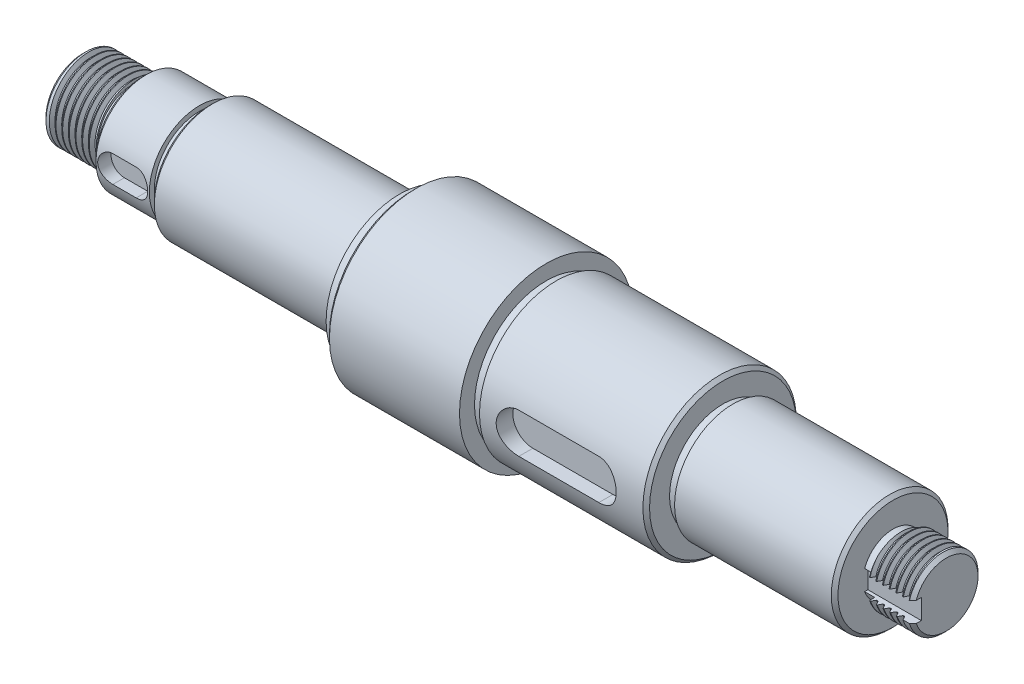
from build123d import *

# Parameters (mm, degrees)
SKETCH_1_W          = 3
SKETCH_1_H          = 10.5
SKETCH_1_H_2        = 13.5
SKETCH_1_H_3        = 16
SKETCH_1_H_4        = 21.5
CUT_EXTRUDE_1_DEPTH = 4
CUT_EXTRUDE_2_DEPTH = 5
SKETCH_4_W          = 16
SKETCH_4_H          = 6
CUT_EXTRUDE_3_DEPTH = 3
THREAD_4_PITCH      = 2
THREAD_5_PITCH      = 2


with BuildPart() as part:
    # 草图1 → 旋转1 (revolve)
    with BuildSketch(Plane.XY, mode=Mode.PRIVATE) as revolve_1_sk:
        Polygon((-212.024960712, 44.781802137), (-212.024960712, 46.281802137), (-226.024960712, 46.281802137), (-227.024960712, 45.281802137), (-227.024960712, 34.281802137), (-212.024960712, 34.281802137), align=None)
        with Locations((-210.524960712, 39.531802137)):
            Rectangle(SKETCH_1_W, SKETCH_1_H)
        Polygon((-209.024960712, 46.507366847), (-209.024960712, 44.781802137), (-209.024960712, 34.281802137), (-192.024960712, 34.281802137), (-192.024960712, 47.781802137), (-192.024960712, 49.281802137), (-208.024960712, 49.281802137), (-209.024960712, 48.281802137), align=None)
        with Locations((-190.524960712, 41.031802137)):
            Rectangle(SKETCH_1_W, SKETCH_1_H_2)
        Polygon((-189.024960712, 47.781802137), (-189.024960712, 34.281802137), (-135.024960712, 34.281802137), (-135.024960712, 50.281802137), (-135.024960712, 51.781802137), (-188.024960712, 51.781802137), (-189.024960712, 50.781802137), (-189.024960712, 49.281802137), align=None)
        with Locations((-133.524960712, 42.281802137)):
            Rectangle(SKETCH_1_W, SKETCH_1_H_3)
        Polygon((-132.024960712, 50.281802137), (-132.024960712, 34.281802137), (-128.024960712, 34.281802137), (-128.024960712, 56.281802137), (-132.024960712, 56.281802137), (-132.024960712, 51.781802137), align=None)
        Polygon((-128.024960712, 56.281802137), (-128.024960712, 34.281802137), (-88.024960712, 34.281802137), (-88.024960712, 55.781802137), (-88.024960712, 57.281802137), (-88.024960712, 60.281802137), (-127.024960712, 60.281802137), (-128.024960712, 59.281802137), align=None)
        Polygon((-85.024960712, 55.781802137), (-85.024960712, 34.281802137), (-35.024960712, 34.281802137), (-35.024960712, 50.281802137), (-35.024960712, 51.781802137), (-35.024960712, 56.281802137), (-36.024960712, 57.281802137), (-85.024960712, 57.281802137), align=None)
        with Locations((-86.524960712, 45.031802137)):
            Rectangle(SKETCH_1_W, SKETCH_1_H_4)
        with Locations((-33.524960712, 42.281802137)):
            Rectangle(SKETCH_1_W, SKETCH_1_H_3)
        Polygon((-32.024960712, 50.281802137), (-32.024960712, 34.281802137), (15.975039288, 34.281802137), (15.975039288, 42.8463656), (15.975039288, 43.281802137), (15.975039288, 50.781802137), (14.975039288, 51.781802137), (-32.024960712, 51.781802137), align=None)
        Polygon((15.975039288, 42.8463656), (15.975039288, 34.281802137), (18.975039288, 34.281802137), (18.975039288, 43.281802137), (15.975039288, 43.281802137), align=None)
        Polygon((18.975039288, 43.281802137), (18.975039288, 34.281802137), (31.975039288, 34.281802137), (31.975039288, 43.781802137), (30.975039288, 44.781802137), (18.975039288, 44.781802137), align=None)
    revolve(revolve_1_sk.sketch.rotate(Axis((-286.390670807, 34.281802137, 0), (1, 0, 0)), 90), axis=Axis((-286.390670807, 34.281802137, 0), (1, 0, 0)))

    # 草图2 → 切除-拉伸1 (cut)
    with BuildSketch(Plane.XY.offset(15)):
        with BuildLine():
            Line((-196.524960712, 30.281802137), (-203.524960712, 30.281802137))
            ThreePointArc((-203.524960712, 30.281802137), (-207.524960712, 34.281802137), (-203.524960712, 38.281802137))
            Line((-203.524960712, 38.281802137), (-196.524960712, 38.281802137))
            ThreePointArc((-196.524960712, 38.281802137), (-192.524960712, 34.281802137), (-196.524960712, 30.281802137))
        make_face()
    extrude(amount=-CUT_EXTRUDE_1_DEPTH, mode=Mode.SUBTRACT)

    # 草图3 → 切除-拉伸2 (cut)
    with BuildSketch(Plane.XY.offset(23)):
        with BuildLine():
            Line((-74.024960712, 40.281802137), (-50.024960712, 40.281802137))
            ThreePointArc((-50.024960712, 40.281802137), (-44.024960712, 34.281802137), (-50.024960712, 28.281802137))
            Line((-50.024960712, 28.281802137), (-74.024960712, 28.281802137))
            ThreePointArc((-74.024960712, 28.281802137), (-80.024960712, 34.281802137), (-74.024960712, 40.281802137))
        make_face()
    extrude(amount=-CUT_EXTRUDE_2_DEPTH, mode=Mode.SUBTRACT)

    # Sketch 4 → 切除-拉伸3 (cut)
    with BuildSketch(Plane.XY.offset(10.5)):
        with Locations((23.975039288, 34.281802137)):
            Rectangle(SKETCH_4_W, SKETCH_4_H)
    extrude(amount=-CUT_EXTRUDE_3_DEPTH, mode=Mode.SUBTRACT)

    # 螺纹线4: the profile of Sketch 4 2 profile screwed along a right-hand helix of 7 turns, 10 arcs to a turn; built about Z, then put on its axis
    thread_4_z = Axis((0, 0, 0), (0, 0, 1))
    thread_4_corners = [(12.0003, 0, -0.000173205), (12.0003, 0, 1.7501732), (10.91746825, 0, 1.124999997), (10.91746825, 0, 0.624999997)]
    with BuildLine(mode=Mode.PRIVATE) as thread_4_profile:
        Line(thread_4_corners[0], thread_4_corners[1])
        Line(thread_4_corners[1], thread_4_corners[2])
        Line(thread_4_corners[2], thread_4_corners[3])
        Line(thread_4_corners[3], thread_4_corners[0])
    thread_4_cap = Face(thread_4_profile.wire())
    thread_4_turn_angles = [0, 18, 36, 54, 72, 90, 108, 126, 144, 162, 180, 198, 216, 234, 252, 270, 288, 306, 324, 342, 360]
    thread_4_turn_weights = [1, 0.9510565162951535, 1, 0.9510565162951535, 1, 0.9510565162951535, 1, 0.9510565162951535, 1, 0.9510565162951535, 1, 0.9510565162951535, 1, 0.9510565162951535, 1, 0.9510565162951535, 1, 0.9510565162951535, 1, 0.9510565162951535, 1]
    thread_4_turn_rails = [Edge.make_bspline([Vector(p[0], p[1], 0).rotate(thread_4_z, thread_4_turn_angles[k]) / thread_4_turn_weights[k] + Vector(0, 0, p[2] + THREAD_4_PITCH * thread_4_turn_angles[k] / 360) for k in range(21)], [0, 0, 0, 1, 1, 2, 2, 3, 3, 4, 4, 5, 5, 6, 6, 7, 7, 8, 8, 9, 9, 10, 10, 10], 2, thread_4_turn_weights) for p in thread_4_corners]
    thread_4_turn_sides = [Face.make_surface_from_curves(thread_4_turn_rails[p[0]], thread_4_turn_rails[p[1]]) for p in [(0, 1), (1, 2), (2, 3), (3, 0)]]
    thread_4 = Plane(origin=(-226.024960712, 34.281802137, 0), x_dir=(0, 0, -1), z_dir=(1, 0, 0)) * Solid(Shell([*[p.moved(Location((0, 0, THREAD_4_PITCH * i))) for i in range(7) for p in thread_4_turn_sides], thread_4_cap, thread_4_cap.rotate(thread_4_z, 2520).moved(Location((0, 0, THREAD_4_PITCH * 2520 / 360)))]))
    add(thread_4, mode=Mode.SUBTRACT)

    # 螺纹线5: the profile of 螺纹线轮廓5 profile screwed along a right-hand helix of 6 turns, 10 arcs to a turn; built about Z, then put on its axis
    thread_5_z = Axis((0, 0, 0), (0, 0, 1))
    thread_5_corners = [(10.5003, 0, -0.000173205), (10.5003, 0, 1.7501732), (9.41746825, 0, 1.124999997), (9.41746825, 0, 0.624999997)]
    with BuildLine(mode=Mode.PRIVATE) as thread_5_profile:
        Line(thread_5_corners[0], thread_5_corners[1])
        Line(thread_5_corners[1], thread_5_corners[2])
        Line(thread_5_corners[2], thread_5_corners[3])
        Line(thread_5_corners[3], thread_5_corners[0])
    thread_5_cap = Face(thread_5_profile.wire())
    thread_5_turn_angles = [0, 18, 36, 54, 72, 90, 108, 126, 144, 162, 180, 198, 216, 234, 252, 270, 288, 306, 324, 342, 360]
    thread_5_turn_weights = [1, 0.9510565162951535, 1, 0.9510565162951535, 1, 0.9510565162951535, 1, 0.9510565162951535, 1, 0.9510565162951535, 1, 0.9510565162951535, 1, 0.9510565162951535, 1, 0.9510565162951535, 1, 0.9510565162951535, 1, 0.9510565162951535, 1]
    thread_5_turn_rails = [Edge.make_bspline([Vector(p[0], p[1], 0).rotate(thread_5_z, thread_5_turn_angles[k]) / thread_5_turn_weights[k] + Vector(0, 0, p[2] + THREAD_5_PITCH * thread_5_turn_angles[k] / 360) for k in range(21)], [0, 0, 0, 1, 1, 2, 2, 3, 3, 4, 4, 5, 5, 6, 6, 7, 7, 8, 8, 9, 9, 10, 10, 10], 2, thread_5_turn_weights) for p in thread_5_corners]
    thread_5_turn_sides = [Face.make_surface_from_curves(thread_5_turn_rails[p[0]], thread_5_turn_rails[p[1]]) for p in [(0, 1), (1, 2), (2, 3), (3, 0)]]
    thread_5 = Plane(origin=(30.975039288, 34.281802137, 0), x_dir=(0, 0, 1), z_dir=(-1, 0, 0)) * Solid(Shell([*[p.moved(Location((0, 0, THREAD_5_PITCH * i))) for i in range(6) for p in thread_5_turn_sides], thread_5_cap, thread_5_cap.rotate(thread_5_z, 2160).moved(Location((0, 0, THREAD_5_PITCH * 2160 / 360)))]))
    add(thread_5, mode=Mode.SUBTRACT)


solid = part.part
